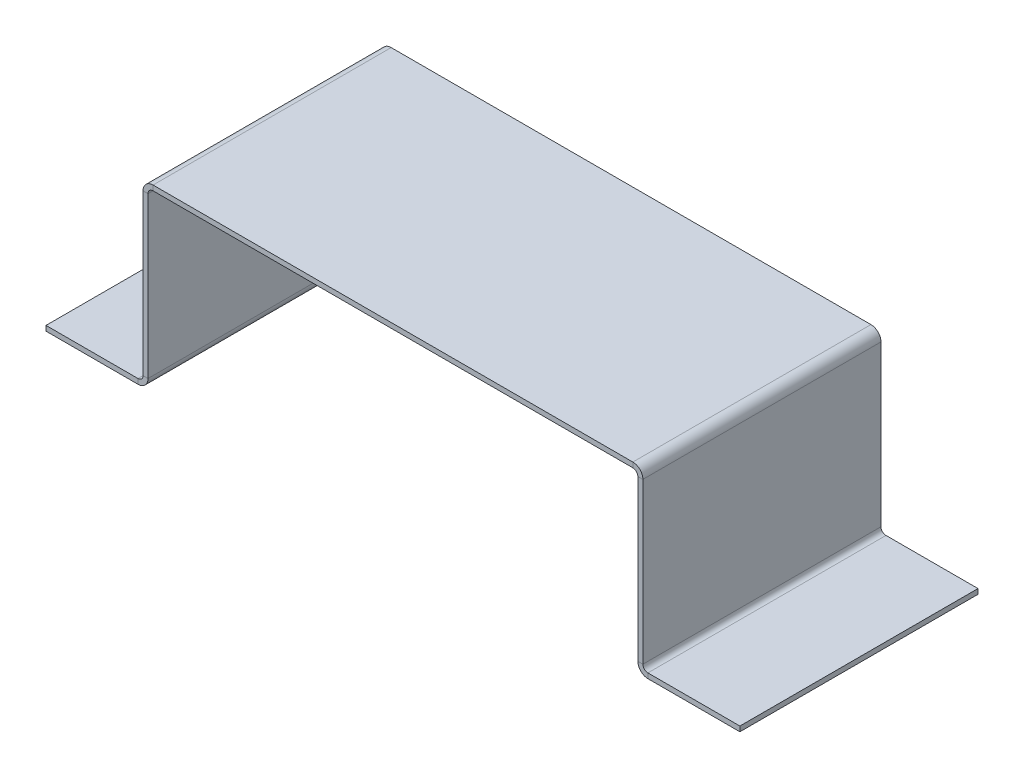
from build123d import *

# Parameters (mm, degrees)
SKETCH1_W                      = 72
SKETCH1_H                      = 35
BASE_FLANGE1_DEPTH             = 0.7366
EDGE_FLANGE1_STRIP_W           = 4.4196
EDGE_FLANGE1_STRIP_H           = 0.7366
EDGE_FLANGE1_STRIP_CUT_DEPTH   = 35
EDGE_FLANGE1_STRIP_2_W         = 4.4196
EDGE_FLANGE1_STRIP_2_H         = 0.7366
EDGE_FLANGE1_STRIP_CUT_2_DEPTH = 35
EDGE_FLANGE1_DEPTH             = 35
EDGE_FLANGE1_BEND_DEPTH        = 35
EDGE_FLANGE2_STRIP_W           = 4.4196
EDGE_FLANGE2_STRIP_H           = 0.7366
EDGE_FLANGE2_STRIP_CUT_DEPTH   = 35
EDGE_FLANGE2_STRIP_2_W         = 4.4196
EDGE_FLANGE2_STRIP_2_H         = 0.7366
EDGE_FLANGE2_STRIP_CUT_2_DEPTH = 35
EDGE_FLANGE2_DEPTH             = 35
EDGE_FLANGE2_BEND_DEPTH        = 35


# Sheet-metal steps are written as plain solids
with BuildPart() as part:
    # Sketch1 → Base-Flange1 (new body)
    with BuildSketch(Plane(origin=(0, 0, 0), x_dir=(1, 0, 0), z_dir=(0, 1, 0))):
        Rectangle(SKETCH1_W, SKETCH1_H)
    extrude(amount=-BASE_FLANGE1_DEPTH)

    # Edge-Flange1 strip (across the edge) → Edge-Flange1 strip cut (cut)
    with BuildSketch(Plane(origin=(36, -0.7366, -17.5), x_dir=(-1, 0, 0), z_dir=(0, 0, 1))):
        with Locations((-1.4732, -0.3683)):
            Rectangle(EDGE_FLANGE1_STRIP_W, EDGE_FLANGE1_STRIP_H)
    extrude(amount=EDGE_FLANGE1_STRIP_CUT_DEPTH, mode=Mode.SUBTRACT)

    # Edge-Flange1 strip 2 (across the edge) → Edge-Flange1 strip cut 2 (cut)
    with BuildSketch(Plane(origin=(-36, -0.7366, 17.5), x_dir=(1, 0, 0), z_dir=(0, 0, -1))):
        with Locations((-1.4732, -0.3683)):
            Rectangle(EDGE_FLANGE1_STRIP_2_W, EDGE_FLANGE1_STRIP_2_H)
    extrude(amount=EDGE_FLANGE1_STRIP_CUT_2_DEPTH, mode=Mode.SUBTRACT)

    # Edge-Flange1 section (across the edge) → Edge-Flange1 (add)
    with BuildSketch(Plane(origin=(36, -0.7366, -17.5), x_dir=(-1, 0, 0), z_dir=(0, 0, 1))):
        with BuildLine():
            Line((-0.7366, 0.7366), (-0.7366, 25))
            Line((-0.7366, 25), (0, 25))
            Line((0, 25), (0, 0.7366))
            ThreePointArc((0, 0.7366), (0.215745145, 0.215745145), (0.7366, 0))
            Line((0.7366, 0), (0.7366, -0.7366))
            ThreePointArc((0.7366, -0.7366), (-0.30510971, -0.30510971), (-0.7366, 0.7366))
        make_face()
    extrude(amount=EDGE_FLANGE1_DEPTH)

    # Edge-Flange1 section 2 (across the edge) → Edge-Flange1 bend (add)
    with BuildSketch(Plane(origin=(-36, -0.7366, 17.5), x_dir=(1, 0, 0), z_dir=(0, 0, -1))):
        with BuildLine():
            Line((-0.7366, 0.7366), (-0.7366, 25))
            Line((-0.7366, 25), (0, 25))
            Line((0, 25), (0, 0.7366))
            ThreePointArc((0, 0.7366), (0.215745145, 0.215745145), (0.7366, 0))
            Line((0.7366, 0), (0.7366, -0.7366))
            ThreePointArc((0.7366, -0.7366), (-0.30510971, -0.30510971), (-0.7366, 0.7366))
        make_face()
    extrude(amount=EDGE_FLANGE1_BEND_DEPTH)

    # Edge-Flange2 strip (across the edge) → Edge-Flange2 strip cut (cut)
    with BuildSketch(Plane(origin=(-36.7366, -25.7366, -17.5), x_dir=(0, 1, 0), z_dir=(0, 0, 1))):
        with Locations((-1.4732, -0.3683)):
            Rectangle(EDGE_FLANGE2_STRIP_W, EDGE_FLANGE2_STRIP_H)
    extrude(amount=EDGE_FLANGE2_STRIP_CUT_DEPTH, mode=Mode.SUBTRACT)

    # Edge-Flange2 strip 2 (across the edge) → Edge-Flange2 strip cut 2 (cut)
    with BuildSketch(Plane(origin=(36.7366, -25.7366, 17.5), x_dir=(0, 1, 0), z_dir=(0, 0, -1))):
        with Locations((-1.4732, -0.3683)):
            Rectangle(EDGE_FLANGE2_STRIP_2_W, EDGE_FLANGE2_STRIP_2_H)
    extrude(amount=EDGE_FLANGE2_STRIP_CUT_2_DEPTH, mode=Mode.SUBTRACT)

    # Edge-Flange2 section (across the edge) → Edge-Flange2 (add)
    with BuildSketch(Plane(origin=(-36.7366, -25.7366, -17.5), x_dir=(0, 1, 0), z_dir=(0, 0, 1))):
        with BuildLine():
            Line((-0.7366, 0.7366), (-0.7366, 14.2634))
            Line((-0.7366, 14.2634), (0, 14.2634))
            Line((0, 14.2634), (0, 0.7366))
            ThreePointArc((0, 0.7366), (0.215745145, 0.215745145), (0.7366, 0))
            Line((0.7366, 0), (0.7366, -0.7366))
            ThreePointArc((0.7366, -0.7366), (-0.30510971, -0.30510971), (-0.7366, 0.7366))
        make_face()
    extrude(amount=EDGE_FLANGE2_DEPTH)

    # Edge-Flange2 section 2 (across the edge) → Edge-Flange2 bend (add)
    with BuildSketch(Plane(origin=(36.7366, -25.7366, 17.5), x_dir=(0, 1, 0), z_dir=(0, 0, -1))):
        with BuildLine():
            Line((-0.7366, 0.7366), (-0.7366, 14.2634))
            Line((-0.7366, 14.2634), (0, 14.2634))
            Line((0, 14.2634), (0, 0.7366))
            ThreePointArc((0, 0.7366), (0.215745145, 0.215745145), (0.7366, 0))
            Line((0.7366, 0), (0.7366, -0.7366))
            ThreePointArc((0.7366, -0.7366), (-0.30510971, -0.30510971), (-0.7366, 0.7366))
        make_face()
    extrude(amount=EDGE_FLANGE2_BEND_DEPTH)


solid = part.part
